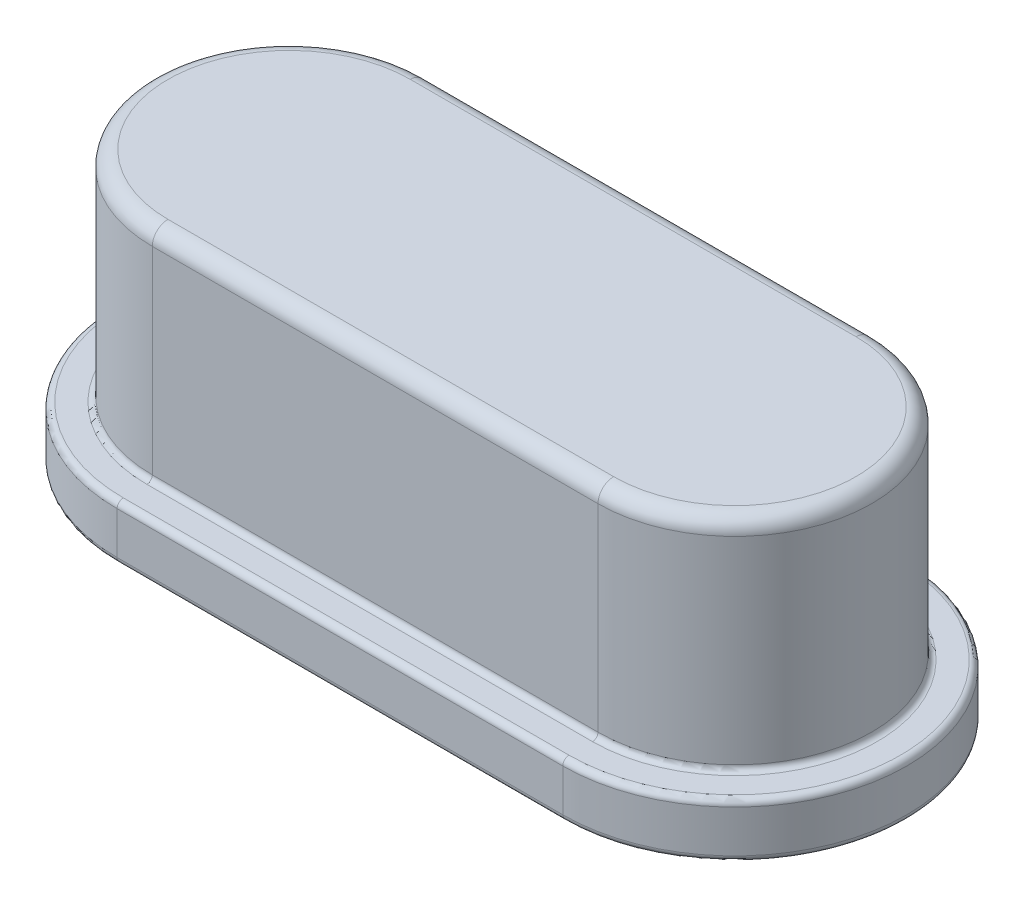
from build123d import *

# Parameters (mm, degrees)
BOSS_EXTRUDE1_DEPTH = 0.7
BOSS_EXTRUDE2_DEPTH = 2.8
FILLET1_R           = 0.2
FILLET2_R           = 0.08
FILLET3_R           = 0.07


with BuildPart() as part:
    # Sketch1 → Boss-Extrude1 (new body)
    with BuildSketch(Plane(origin=(0, 0, 0), x_dir=(1, 0, 0), z_dir=(0, 1, 0))):
        with BuildLine():
            Line((-2.85, 2.2), (2.85, 2.2))
            ThreePointArc((2.85, 2.2), (5.05, 0), (2.85, -2.2))
            Line((2.85, -2.2), (-2.85, -2.2))
            ThreePointArc((-2.85, -2.2), (-5.05, 0), (-2.85, 2.2))
        make_face()
    extrude(amount=BOSS_EXTRUDE1_DEPTH)

    # Sketch2 → Boss-Extrude2 (add)
    with BuildSketch(Plane(origin=(0, 0.7, 0), x_dir=(1, 0, 0), z_dir=(0, 1, 0))):
        with BuildLine():
            Line((-2.85, 1.75), (2.85, 1.75))
            ThreePointArc((2.85, 1.75), (4.6, 0), (2.85, -1.75))
            Line((2.85, -1.75), (-2.85, -1.75))
            ThreePointArc((-2.85, -1.75), (-4.6, 0), (-2.85, 1.75))
        make_face()
    extrude(amount=BOSS_EXTRUDE2_DEPTH)

    # Fillet1
    fillet1_edges = [part.edges().sort_by_distance(p)[0] for p in [
        (-4.6, 3.5, 0),
        (0, 3.5, -1.75),
        (4.6, 3.5, 0),
        (0, 3.5, 1.75),
    ]]
    fillet(fillet1_edges, radius=FILLET1_R)

    # Fillet2
    fillet2_edges = [part.edges().sort_by_distance(p)[0] for p in [
        (-5.05, 0, 0),
        (0, 0, -2.2),
        (5.05, 0, 0),
        (-5.05, 0.7, 0),
        (0, 0.7, -2.2),
        (5.05, 0.7, 0),
        (0, 0, 2.2),
        (0, 0.7, 2.2),
    ]]
    fillet(fillet2_edges, radius=FILLET2_R)

    # Fillet3
    fillet3_edges = [part.edges().sort_by_distance(p)[0] for p in [
        (-4.6, 0.7, 0),
        (0, 0.7, -1.75),
        (4.6, 0.7, 0),
        (0, 0.7, 1.75),
    ]]
    fillet(fillet3_edges, radius=FILLET3_R)


solid = part.part
